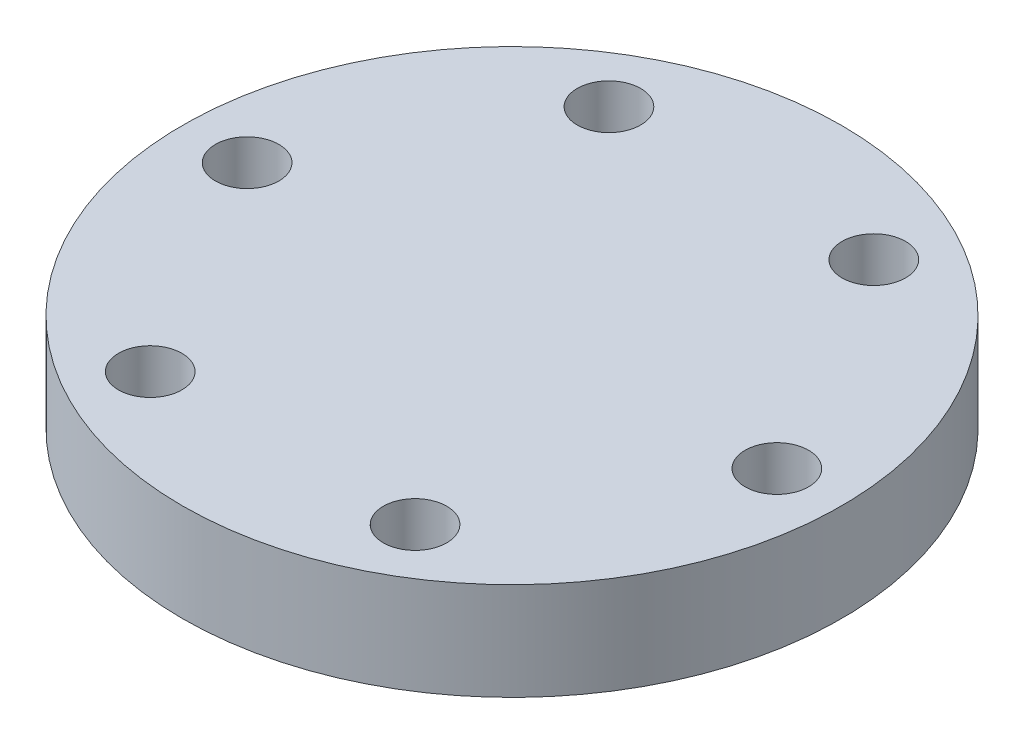
from build123d import *

# Parameters (mm, degrees)
SKETCH1_R           = 27
BOSS_EXTRUDE1_DEPTH = 8
SKETCH2_R           = 2.6
CUT_EXTRUDE1_DEPTH  = 40.012818406


with BuildPart() as part:
    # Sketch1 → Boss-Extrude1 (new body)
    with BuildSketch(Plane(origin=(0, 0, 0), x_dir=(1, 0, 0), z_dir=(0, 1, 0))):
        Circle(SKETCH1_R)
    extrude(amount=BOSS_EXTRUDE1_DEPTH)

    # Sketch2 → Cut-Extrude1 (cut, through all)
    with BuildSketch(Plane(origin=(0, 8, 0), x_dir=(1, 0, 0), z_dir=(0, 1, 0))):
        with Locations((-21.7, 0)):
            Circle(SKETCH2_R)
        with Locations((-10.85, 18.792751262)):
            Circle(SKETCH2_R)
        with Locations((10.85, 18.792751262)):
            Circle(SKETCH2_R)
        with Locations((21.7, 0)):
            Circle(SKETCH2_R)
        with Locations((10.85, -18.792751262)):
            Circle(SKETCH2_R)
        with Locations((-10.85, -18.792751262)):
            Circle(SKETCH2_R)
    extrude(amount=-CUT_EXTRUDE1_DEPTH, mode=Mode.SUBTRACT)


solid = part.part
